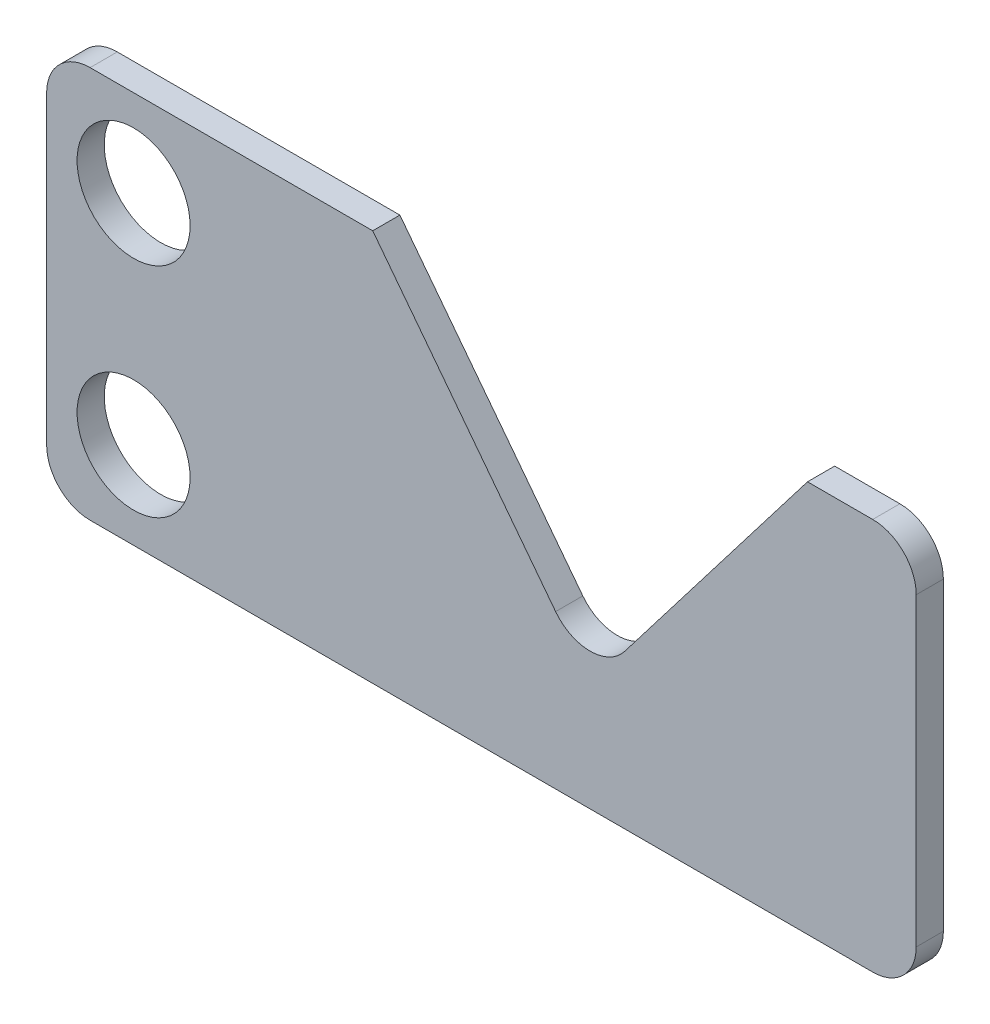
from build123d import *

# Parameters (mm, degrees)
SKETCH2_R           = 3.302
BOSS_EXTRUDE1_DEPTH = 1.5875


with BuildPart() as part:
    # Sketch2 → Boss-Extrude1 (new body)
    with BuildSketch(Plane.XY):
        with BuildLine():
            Line((19.05, 22.900962235), (29.734882516, 8.976152235))
            ThreePointArc((29.734882516, 8.976152235), (31.75, 7.982406265), (33.765117484, 8.976152235))
            Line((33.765117484, 8.976152235), (44.45, 22.900962235))
            Line((44.45, 22.900962235), (48.26, 22.900962235))
            ThreePointArc((48.26, 22.900962235), (50.056051224, 22.157013459), (50.8, 20.360962235))
            Line((50.8, 20.360962235), (50.8, 2.54))
            ThreePointArc((50.8, 2.54), (50.056051224, 0.743948776), (48.26, 0))
            Line((48.26, 0), (2.54, 0))
            ThreePointArc((2.54, 0), (0.743948776, 0.743948776), (0, 2.54))
            Line((0, 2.54), (0, 20.360962235))
            ThreePointArc((0, 20.360962235), (0.743948776, 22.157013459), (2.54, 22.900962235))
            Line((2.54, 22.900962235), (19.05, 22.900962235))
        make_face()
        with Locations((5.08, 17.820962235)):
            Circle(SKETCH2_R, mode=Mode.SUBTRACT)
        with Locations((5.08, 5.08)):
            Circle(SKETCH2_R, mode=Mode.SUBTRACT)
    extrude(amount=BOSS_EXTRUDE1_DEPTH)


solid = part.part
